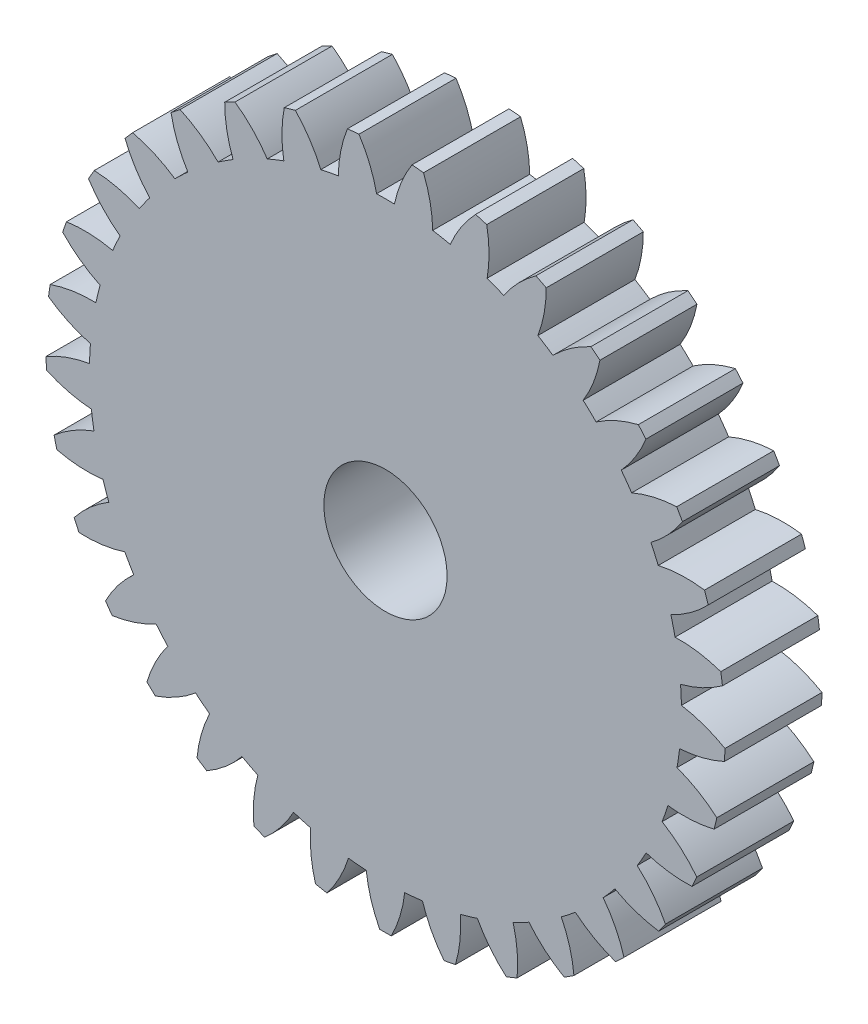
from build123d import *

# Parameters (mm, degrees)
CROQUIS1_R              = 3.175
SALIENTE_EXTRUIR1_DEPTH = 5


with BuildPart() as part:
    # Croquis1 → Saliente-Extruir1 (new body)
    with BuildSketch(Plane.XY):
        with BuildLine():
            ThreePointArc((2.432853295, 15.05367815), (2.30290802, 16.243278252), (1.96029505, 17.389860359))
            ThreePointArc((1.96029505, 17.389860359), (1.663480758, 17.420758645), (1.366182748, 17.446591206))
            ThreePointArc((1.366182748, 17.446591206), (0.812769149, 16.385569262), (0.460038855, 15.242059088))
            ThreePointArc((0.460038855, 15.242059088), (0, 15.249), (-0.460038855, 15.242059088))
            ThreePointArc((-0.460038855, 15.242059088), (-0.812769149, 16.385569262), (-1.366182748, 17.446591206))
            ThreePointArc((-1.366182748, 17.446591206), (-1.663480758, 17.420758645), (-1.96029505, 17.389860359))
            ThreePointArc((-1.96029505, 17.389860359), (-2.30290802, 16.243278252), (-2.432853295, 15.05367815))
            ThreePointArc((-2.432853295, 15.05367815), (-2.885892225, 14.973430705), (-3.336304003, 14.879552298))
            ThreePointArc((-3.336304003, 14.879552298), (-3.899070724, 15.935643106), (-4.643283141, 16.872756789))
            ThreePointArc((-4.643283141, 16.872756789), (-4.930319745, 16.791127038), (-5.215922677, 16.704614651))
            ThreePointArc((-5.215922677, 16.704614651), (-5.335352094, 15.513912845), (-5.237815789, 14.321218061))
            ThreePointArc((-5.237815789, 14.321218061), (-5.667480786, 14.156682611), (-6.091986431, 13.97925972))
            ThreePointArc((-6.091986431, 13.97925972), (-6.844449724, 14.909761289), (-7.752563184, 15.689096981))
            ThreePointArc((-7.752563184, 15.689096981), (-8.01896413, 15.554620351), (-8.283033268, 15.415620645))
            ThreePointArc((-8.283033268, 15.415620645), (-8.174962642, 14.223834206), (-7.853469973, 13.071151838))
            ThreePointArc((-7.853469973, 13.071151838), (-8.244231825, 12.828275122), (-8.627488597, 12.573720273))
            ThreePointArc((-8.627488597, 12.573720273), (-9.542452478, 13.345001851), (-10.581645394, 13.93839233))
            ThreePointArc((-10.581645394, 13.93839233), (-10.817782259, 13.755929158), (-11.050773456, 13.569465945))
            ThreePointArc((-11.050773456, 13.569465945), (-10.71910874, 12.41966914), (-10.18527929, 11.348660131))
            ThreePointArc((-10.18527929, 11.348660131), (-10.523014846, 11.036220347), (-10.851170847, 10.713733815))
            ThreePointArc((-10.851170847, 10.713733815), (-11.895566137, 11.297919277), (-13.02827937, 11.683917864))
            ThreePointArc((-13.02827937, 11.683917864), (-13.225617551, 11.460062844), (-13.419109899, 11.23287539))
            ThreePointArc((-13.419109899, 11.23287539), (-12.87583832, 10.166624871), (-12.148966076, 9.215998279))
            ThreePointArc((-12.148966076, 9.215998279), (-12.421468693, 8.845287814), (-12.68266351, 8.466525102))
            ThreePointArc((-12.68266351, 8.466525102), (-13.818743042, 8.842500464), (-15.004037384, 9.007156165))
            ThreePointArc((-15.004037384, 9.007156165), (-15.155444566, 8.75), (-15.302444747, 8.490299451))
            ThreePointArc((-15.302444747, 8.490299451), (-14.567201556, 7.546132291), (-13.673557575, 6.750246236))
            ThreePointArc((-13.673557575, 6.750246236), (-13.870978297, 6.334663533), (-14.055771669, 5.913314113))
            ThreePointArc((-14.055771669, 5.913314113), (-15.242474569, 6.067490645), (-16.437510395, 6.004852374))
            ThreePointArc((-16.437510395, 6.004852374), (-16.537514328, 5.723689358), (-16.632709371, 5.44086197))
            ThreePointArc((-16.632709371, 5.44086197), (-15.732068173, 4.652902829), (-14.703951076, 4.040522707))
            ThreePointArc((-14.703951076, 4.040522707), (-14.819154605, 3.595088008), (-14.920867618, 3.146380544))
            ThreePointArc((-14.920867618, 3.146380544), (-16.115303351, 3.073185905), (-17.276888952, 2.785517572))
            ThreePointArc((-17.276888952, 2.785517572), (-17.321875233, 2.49050967), (-17.361824543, 2.19477756))
            ThreePointArc((-17.361824543, 2.19477756), (-16.328336856, 1.591505335), (-15.202905475, 1.18476416))
            ThreePointArc((-15.202905475, 1.18476416), (-15.231728055, 0.725576634), (-15.246684535, 0.265728585))
            ThreePointArc((-15.246684535, 0.265728585), (-16.405683083, -0.03219178), (-17.491835728, -0.534493092))
            ThreePointArc((-17.491835728, -0.534493092), (-17.480178436, -0.832683527), (-17.46343814, -1.130631829))
            ThreePointArc((-17.46343814, -1.130631829), (-16.334456903, -1.527413308), (-15.152387259, -1.713814851))
            ThreePointArc((-15.152387259, -1.713814851), (-15.093787167, -2.170158969), (-15.021446549, -2.624527497))
            ThreePointArc((-15.021446549, -2.624527497), (-16.103118683, -3.136405971), (-17.074581986, -3.835185783))
            ThreePointArc((-17.074581986, -3.835185783), (-17.006702446, -4.125781371), (-16.933877582, -4.415177237))
            ThreePointArc((-16.933877582, -4.415177237), (-15.750207118, -4.591127255), (-14.554222289, -4.550452128))
            ThreePointArc((-14.554222289, -4.550452128), (-14.410317485, -4.987459373), (-14.253294346, -5.419926318))
            ThreePointArc((-14.253294346, -5.419926318), (-15.218545617, -6.127262278), (-16.040208364, -6.997264868))
            ThreePointArc((-16.040208364, -6.997264868), (-15.918559919, -7.269762728), (-15.792282567, -7.540146637))
            ThreePointArc((-15.792282567, -7.540146637), (-14.596703811, -7.4889059), (-13.430029804, -7.222624209))
            ThreePointArc((-13.430029804, -7.222624209), (-13.206021382, -7.6245), (-12.969990949, -8.01943488))
            ThreePointArc((-12.969990949, -8.01943488), (-13.783934661, -8.896663362), (-14.42609982, -9.906444569))
            ThreePointArc((-14.42609982, -9.906444569), (-14.255079161, -10.150995918), (-14.079913315, -10.392595492))
            ThreePointArc((-14.079913315, -10.392595492), (-12.915637597, -10.116015974), (-11.820441051, -9.633751832))
            ThreePointArc((-11.820441051, -9.633751832), (-11.524425259, -9.985971332), (-11.217918286, -10.32910017))
            ThreePointArc((-11.217918286, -10.32910017), (-11.851136393, -11.344515851), (-12.290594441, -12.457579552))
            ThreePointArc((-12.290594441, -12.457579552), (-12.076382701, -12.665345667), (-11.85865931, -12.869428868))
            ThreePointArc((-11.85865931, -12.869428868), (-10.767766589, -12.377506874), (-9.78363076, -11.696690564))
            ThreePointArc((-9.78363076, -11.696690564), (-9.426306381, -11.986523642), (-9.060400828, -12.265444869))
            ThreePointArc((-9.060400828, -12.265444869), (-9.490007178, -13.382347981), (-9.710874956, -14.558465152))
            ThreePointArc((-9.710874956, -14.558465152), (-9.461214305, -14.721936825), (-9.20880246, -14.881127553))
            ThreePointArc((-9.20880246, -14.881127553), (-8.230720441, -14.191642426), (-7.393214562, -13.336880424))
            ThreePointArc((-7.393214562, -13.336880424), (-6.98749623, -13.553851757), (-6.575416878, -13.758484433))
            ThreePointArc((-6.575416878, -13.758484433), (-6.785884378, -14.936507186), (-6.780179149, -16.13316989))
            ThreePointArc((-6.780179149, -16.13316989), (-6.504092974, -16.246438828), (-6.226115496, -16.354983517))
            ThreePointArc((-6.226115496, -16.354983517), (-5.396194611, -15.492855045), (-4.735588328, -14.495040676))
            ThreePointArc((-4.735588328, -14.495040676), (-4.296139759, -14.631308355), (-3.852780229, -14.754256522))
            ThreePointArc((-3.852780229, -14.754256522), (-3.836502035, -15.950822106), (-3.604430001, -17.124779834))
            ThreePointArc((-3.604430001, -17.124779834), (-3.311896776, -17.183752202), (-3.018400496, -17.237727764))
            ThreePointArc((-3.018400496, -17.237727764), (-2.366636249, -16.234115516), (-1.906805592, -15.129312391))
            ThreePointArc((-1.906805592, -15.129312391), (-1.449509604, -15.179951347), (-0.990894065, -15.216771338))
            ThreePointArc((-0.990894065, -15.216771338), (-0.748458514, -16.388632755), (-0.298407363, -17.497455616))
            ThreePointArc((-0.298407363, -17.497455616), (0, -17.5), (0.298407363, -17.497455616))
            ThreePointArc((0.298407363, -17.497455616), (0.748458514, -16.388632755), (0.990894065, -15.216771338))
            ThreePointArc((0.990894065, -15.216771338), (1.449509604, -15.179951347), (1.906805592, -15.129312391))
            ThreePointArc((1.906805592, -15.129312391), (2.366636249, -16.234115516), (3.018400496, -17.237727764))
            ThreePointArc((3.018400496, -17.237727764), (3.311896776, -17.183752202), (3.604430001, -17.124779834))
            ThreePointArc((3.604430001, -17.124779834), (3.836502035, -15.950822106), (3.852780229, -14.754256522))
            ThreePointArc((3.852780229, -14.754256522), (4.296139759, -14.631308355), (4.735588328, -14.495040676))
            ThreePointArc((4.735588328, -14.495040676), (5.396194611, -15.492855045), (6.226115496, -16.354983517))
            ThreePointArc((6.226115496, -16.354983517), (6.504092974, -16.246438828), (6.780179149, -16.13316989))
            ThreePointArc((6.780179149, -16.13316989), (6.785884378, -14.936507186), (6.575416878, -13.758484433))
            ThreePointArc((6.575416878, -13.758484433), (6.98749623, -13.553851757), (7.393214562, -13.336880424))
            ThreePointArc((7.393214562, -13.336880424), (8.230720441, -14.191642426), (9.20880246, -14.881127553))
            ThreePointArc((9.20880246, -14.881127553), (9.461214305, -14.721936825), (9.710874956, -14.558465152))
            ThreePointArc((9.710874956, -14.558465152), (9.490007178, -13.382347981), (9.060400828, -12.265444869))
            ThreePointArc((9.060400828, -12.265444869), (9.426306381, -11.986523642), (9.78363076, -11.696690564))
            ThreePointArc((9.78363076, -11.696690564), (10.767766589, -12.377506874), (11.85865931, -12.869428868))
            ThreePointArc((11.85865931, -12.869428868), (12.076382701, -12.665345667), (12.290594441, -12.457579552))
            ThreePointArc((12.290594441, -12.457579552), (11.851136393, -11.344515851), (11.217918286, -10.32910017))
            ThreePointArc((11.217918286, -10.32910017), (11.524425259, -9.985971332), (11.820441051, -9.633751832))
            ThreePointArc((11.820441051, -9.633751832), (12.915637597, -10.116015974), (14.079913315, -10.392595492))
            ThreePointArc((14.079913315, -10.392595492), (14.255079161, -10.150995918), (14.42609982, -9.906444569))
            ThreePointArc((14.42609982, -9.906444569), (13.783934661, -8.896663362), (12.969990949, -8.01943488))
            ThreePointArc((12.969990949, -8.01943488), (13.206021382, -7.6245), (13.430029804, -7.222624209))
            ThreePointArc((13.430029804, -7.222624209), (14.596703811, -7.4889059), (15.792282567, -7.540146637))
            ThreePointArc((15.792282567, -7.540146637), (15.918559919, -7.269762728), (16.040208364, -6.997264868))
            ThreePointArc((16.040208364, -6.997264868), (15.218545617, -6.127262278), (14.253294346, -5.419926318))
            ThreePointArc((14.253294346, -5.419926318), (14.410317485, -4.987459373), (14.554222289, -4.550452128))
            ThreePointArc((14.554222289, -4.550452128), (15.750207118, -4.591127255), (16.933877582, -4.415177237))
            ThreePointArc((16.933877582, -4.415177237), (17.006702446, -4.125781371), (17.074581986, -3.835185783))
            ThreePointArc((17.074581986, -3.835185783), (16.103118683, -3.136405971), (15.021446549, -2.624527497))
            ThreePointArc((15.021446549, -2.624527497), (15.093787167, -2.170158969), (15.152387259, -1.713814851))
            ThreePointArc((15.152387259, -1.713814851), (16.334456903, -1.527413308), (17.46343814, -1.130631829))
            ThreePointArc((17.46343814, -1.130631829), (17.480178436, -0.832683527), (17.491835728, -0.534493092))
            ThreePointArc((17.491835728, -0.534493092), (16.405683083, -0.03219178), (15.246684535, 0.265728585))
            ThreePointArc((15.246684535, 0.265728585), (15.231728055, 0.725576634), (15.202905475, 1.18476416))
            ThreePointArc((15.202905475, 1.18476416), (16.328336856, 1.591505335), (17.361824543, 2.19477756))
            ThreePointArc((17.361824543, 2.19477756), (17.321875233, 2.49050967), (17.276888952, 2.785517572))
            ThreePointArc((17.276888952, 2.785517572), (16.115303351, 3.073185905), (14.920867618, 3.146380544))
            ThreePointArc((14.920867618, 3.146380544), (14.819154605, 3.595088008), (14.703951076, 4.040522707))
            ThreePointArc((14.703951076, 4.040522707), (15.732068173, 4.652902829), (16.632709371, 5.44086197))
            ThreePointArc((16.632709371, 5.44086197), (16.537514328, 5.723689358), (16.437510395, 6.004852374))
            ThreePointArc((16.437510395, 6.004852374), (15.242474569, 6.067490645), (14.055771669, 5.913314113))
            ThreePointArc((14.055771669, 5.913314113), (13.870978297, 6.334663533), (13.673557575, 6.750246236))
            ThreePointArc((13.673557575, 6.750246236), (14.567201556, 7.546132291), (15.302444747, 8.490299451))
            ThreePointArc((15.302444747, 8.490299451), (15.155444566, 8.75), (15.004037384, 9.007156165))
            ThreePointArc((15.004037384, 9.007156165), (13.818743042, 8.842500464), (12.68266351, 8.466525102))
            ThreePointArc((12.68266351, 8.466525102), (12.421468693, 8.845287814), (12.148966076, 9.215998279))
            ThreePointArc((12.148966076, 9.215998279), (12.87583832, 10.166624871), (13.419109899, 11.23287539))
            ThreePointArc((13.419109899, 11.23287539), (13.225617551, 11.460062844), (13.02827937, 11.683917864))
            ThreePointArc((13.02827937, 11.683917864), (11.895566137, 11.297919277), (10.851170847, 10.713733815))
            ThreePointArc((10.851170847, 10.713733815), (10.523014846, 11.036220347), (10.18527929, 11.348660131))
            ThreePointArc((10.18527929, 11.348660131), (10.71910874, 12.41966914), (11.050773456, 13.569465945))
            ThreePointArc((11.050773456, 13.569465945), (10.817782259, 13.755929158), (10.581645394, 13.93839233))
            ThreePointArc((10.581645394, 13.93839233), (9.542452478, 13.345001851), (8.627488597, 12.573720273))
            ThreePointArc((8.627488597, 12.573720273), (8.244231825, 12.828275122), (7.853469973, 13.071151838))
            ThreePointArc((7.853469973, 13.071151838), (8.174962642, 14.223834206), (8.283033268, 15.415620645))
            ThreePointArc((8.283033268, 15.415620645), (8.01896413, 15.554620351), (7.752563184, 15.689096981))
            ThreePointArc((7.752563184, 15.689096981), (6.844449724, 14.909761289), (6.091986431, 13.97925972))
            ThreePointArc((6.091986431, 13.97925972), (5.667480786, 14.156682611), (5.237815789, 14.321218061))
            ThreePointArc((5.237815789, 14.321218061), (5.335352094, 15.513912845), (5.215922677, 16.704614651))
            ThreePointArc((5.215922677, 16.704614651), (4.930319745, 16.791127038), (4.643283141, 16.872756789))
            ThreePointArc((4.643283141, 16.872756789), (3.899070724, 15.935643106), (3.336304003, 14.879552298))
            ThreePointArc((3.336304003, 14.879552298), (2.885892225, 14.973430705), (2.432853295, 15.05367815))
        make_face()
        Circle(CROQUIS1_R, mode=Mode.SUBTRACT)
    extrude(amount=SALIENTE_EXTRUIR1_DEPTH)


solid = part.part
